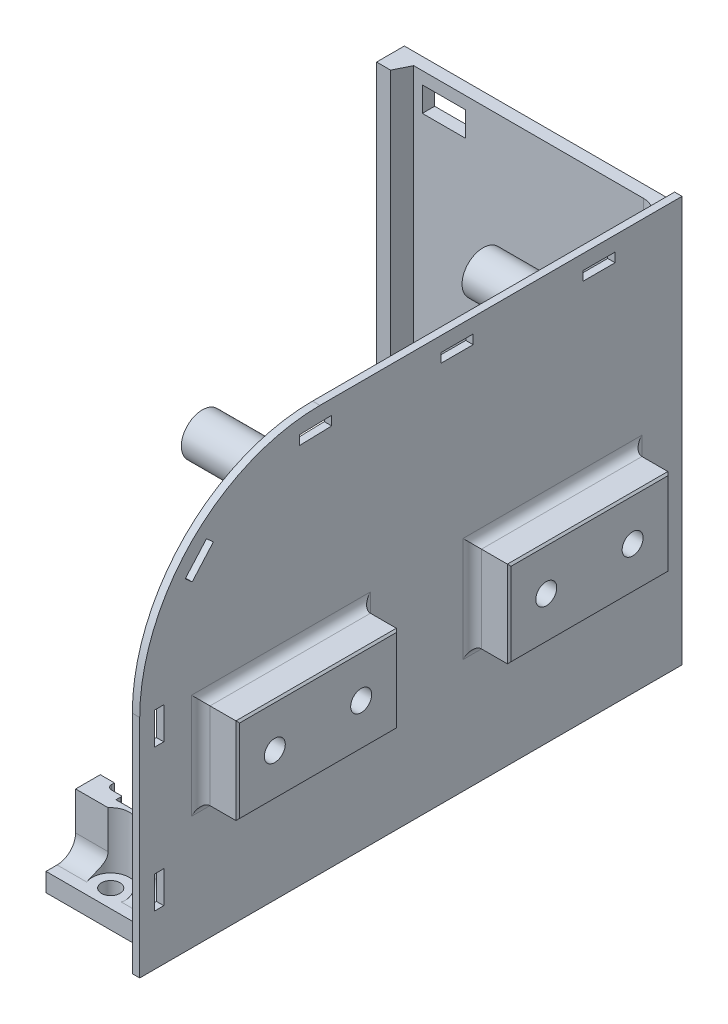
from build123d import *

# Parameters (mm, degrees)
EXTRUDE_1_DEPTH                 = 2
EXTRUDE_2_DEPTH                 = 1.2
SKETCH_4_R                      = 1.55
EXTRUDE_3_DEPTH                 = 4
EXTRUDE_START                   = 3
SKETCH_4_3_R                    = 1.55
EXTRUDE_4_DEPTH                 = 4
FILLET_1_R                      = 3
SKETCH_5_W                      = 3.5
SKETCH_5_H                      = 2.5
EXTRUDE_5_DEPTH                 = 59.375418161
SKETCH_9_W                      = 7
SKETCH_9_H                      = 4
CUT_EXTRUDE_3_DEPTH             = 2
OTHER_START                     = -350.004341608
OTHER_1_OUTLINE_W               = 1.5
OTHER_1_OUTLINE_H               = 5.2
OTHER_1_OUTLINE_W_2             = 5.2
OTHER_1_OUTLINE_H_2             = 1.5
OTHER_1_DEPTH                   = 1.2
SKETCH_10_R                     = 3.4
SKETCH_10_R_2                   = 1.1
EXTRUDE_6_DEPTH                 = 13.8
EXTRUDE_7_DEPTH                 = 2.4
CHAMFER_1_SIZE2                 = 1.219331471
CHAMFER_1_SIZE                  = 2.5
EXTRUDE_9_DEPTH                 = 15.389983971
SKETCH_15_R                     = 1.5
CUT_EXTRUDE_4_DEPTH             = 407.679532375
FILLET_2_R                      = 3
SKETCH_16_R                     = 3
CUT_EXTRUDE_5_DEPTH             = 408.922716855
SKETCH_17_W                     = 26
SKETCH_17_H                     = 14
EXTRUDE_10_DEPTH                = 6
CUT_EXTRUDE_6_REACH             = 113.55
SKETCH_18_R                     = 1.7
CUT_EXTRUDE_6_DIRECTION_2_DEPTH = 112.550133095
PATTERN_LINEAR_1_COUNT          = 2
PATTERN_LINEAR_1_PITCH          = 44
FILLET_3_R                      = 1.5
CHAMFER_2_SIZE                  = 0.3


# Read off the part's stored shape, not the designer's step: Отступ1
# Some blends are built 0.0001 mm under size
with BuildPart() as part:
    # Эскиз2 → Бобышка-Вытянуть1 (new body)
    with BuildSketch(Plane.XY.offset(0.1)):
        Polygon((-376.904341608, -14.952219826), (-393.804341608, -14.952219826), (-393.804341608, 44.423198335), (-348.804341608, 44.423198335), (-348.804341608, -19.952219826), (-376.904341608, -19.952219826), align=None)
    extrude(amount=EXTRUDE_1_DEPTH)

    # Эскиз3 → Бобышка-Вытянуть2 (add)
    with BuildSketch(Plane(origin=(-348.804341608, 0, 0), x_dir=(0, 0, -1), z_dir=(1, 0, 0))):
        with BuildLine():
            Line((-0.1, -19.952219826), (-0.1, 45.823198335))
            Line((-0.1, 45.823198335), (-58.7849644, 45.823198335))
            ThreePointArc((-58.7849644, 45.823198335), (-79.43775717, 37.268531468), (-87.992424037, 16.615738698))
            Line((-87.992424037, 16.615738698), (-87.992424037, -19.952219826))
            Line((-87.992424037, -19.952219826), (-0.1, -19.952219826))
        make_face()
    extrude(amount=-EXTRUDE_2_DEPTH)

    # Эскиз4 → Бобышка-Вытянуть3 (add)
    with BuildSketch(Plane(origin=(0, -17.952219826, 0), x_dir=(1, 0, 0), z_dir=(0, 1, 0))):
        with BuildLine():
            Line((-357.604341608, -2.1), (-357.604341608, -5.7))
            ThreePointArc((-357.604341608, -5.7), (-356.608504664, -8.104163056), (-354.204341608, -9.1))
            Line((-354.204341608, -9.1), (-350.004341608, -9.1))
            Line((-350.004341608, -9.1), (-350.004341608, -2.1))
            Line((-350.004341608, -2.1), (-357.604341608, -2.1))
        make_face()
        with Locations(Location((-354.204341608, -5.7, 0), (0, 0, 270))):
            Circle(SKETCH_4_R, mode=Mode.SUBTRACT)
    extrude(amount=EXTRUDE_3_DEPTH)

    # Эскиз4<3> → Бобышка-Вытянуть4 (add)
    with BuildSketch(Plane(origin=(0, -17.952219826, 0), x_dir=(1, 0, 0), z_dir=(0, 1, 0)).offset(EXTRUDE_START)):
        with BuildLine():
            Line((-390.304341608, -5.7), (-390.304341608, -2.1))
            Line((-390.304341608, -2.1), (-381.365657691, -2.1))
            Line((-381.365657691, -2.1), (-383.84844185, -7.190461899))
            ThreePointArc((-383.84844185, -7.190461899), (-387.669175192, -9.01285822), (-390.304341608, -5.7))
        make_face()
        with Locations(Location((-386.904341608, -5.7, 0), (0, 0, 180))):
            Circle(SKETCH_4_3_R, mode=Mode.SUBTRACT)
    extrude(amount=EXTRUDE_4_DEPTH)

    # Скругление1
    fillet_1_edges = [part.edges().sort_by_distance(p)[0] for p in [
        (-350.004341608, -18.952219826, 2.1),
        (-350.004341608, 15.235489254, 2.1),
    ]]
    fillet(fillet_1_edges, radius=FILLET_1_R)

    # Эскиз5 → Бобышка-Вытянуть5 (add)
    with BuildSketch(Plane(origin=(0, 44.423198335, 0), x_dir=(1, 0, 0), z_dir=(0, 1, 0))):
        with Locations((-392.054341608, -3.35)):
            Rectangle(SKETCH_5_W, SKETCH_5_H)
    extrude(amount=-EXTRUDE_5_DEPTH)

    # Эскиз9 → Вырез-Вытянуть3 (cut)
    with BuildSketch(Plane(origin=(0, 0, 0.1), x_dir=(-1, 0, 0), z_dir=(0, 0, -1))):
        with Locations((385.390488384, 40.423198335)):
            Rectangle(SKETCH_9_W, SKETCH_9_H)
    extrude(amount=-CUT_EXTRUDE_3_DEPTH, mode=Mode.SUBTRACT)

    # Отступ1 outline → Отступ1 (cut)
    with BuildSketch(Plane.YZ.offset(OTHER_START)):
        with Locations((42.673198335, 13.546937644)):
            Rectangle(OTHER_1_OUTLINE_W, OTHER_1_OUTLINE_H)
        with Locations((42.673198335, 36.546937644)):
            Rectangle(OTHER_1_OUTLINE_W, OTHER_1_OUTLINE_H)
        Polygon((41.843105902, 62.072434127), (41.984560077, 56.874358452), (43.484004983, 56.915162541), (43.342550808, 62.113238216), align=None)
        Polygon((31.397725301, 79.490528515), (35.298941914, 76.052431812), (36.290700579, 77.177782758), (32.389483966, 80.615879461), align=None)
        with Locations((13.847780174, 84.842424037)):
            Rectangle(OTHER_1_OUTLINE_W_2, OTHER_1_OUTLINE_H_2)
        with Locations((-9.152219826, 84.842424037)):
            Rectangle(OTHER_1_OUTLINE_W_2, OTHER_1_OUTLINE_H_2)
    extrude(amount=OTHER_1_DEPTH, mode=Mode.SUBTRACT)

    # Эскиз10 → Бобышка-Вытянуть6 (add)
    # profile 1 of 2: a face of its own
    with BuildSketch(Plane.ZY.offset(350.004341608)):
        with Locations(Location((62.85, 36.323198334, 0), (0, 0, 180))):
            Circle(SKETCH_10_R)
        with Locations(Location((62.85, 36.323198334, 0), (0, 0, 180))):
            Circle(SKETCH_10_R_2, mode=Mode.SUBTRACT)
    # profile 2 of 2: a face of its own
    with BuildSketch(Plane.ZY.offset(350.004341608)):
        with Locations(Location((17.35, 36.323198334, 0), (0, 0, 180))):
            Circle(SKETCH_10_R)
        with Locations(Location((17.35, 36.323198334, 0), (0, 0, 180))):
            Circle(SKETCH_10_R_2, mode=Mode.SUBTRACT)
    extrude(amount=EXTRUDE_6_DEPTH)

    # Эскиз12 → Бобышка-Вытянуть7 (add)
    with BuildSketch(Plane.ZY.offset(350.004341608)):
        with BuildLine():
            Line((77.792424037, 16.615738698), (77.792424037, -19.952219826))
            Line((77.792424037, -19.952219826), (79.792424037, -19.952219826))
            Line((79.792424037, -19.952219826), (79.792424037, 16.615738698))
            ThreePointArc((79.792424037, 16.615738698), (73.639481564, 31.470255863), (58.7849644, 37.623198335))
            Line((58.7849644, 37.623198335), (0.1, 37.623198335))
            Line((0.1, 37.623198335), (0.1, 35.623198335))
            Line((0.1, 35.623198335), (58.7849644, 35.623198335))
            ThreePointArc((58.7849644, 35.623198335), (72.225268002, 30.0560423), (77.792424037, 16.615738698))
        make_face()
    extrude(amount=EXTRUDE_7_DEPTH)

    # Фаска1
    chamfer_1_edges = [part.edges().sort_by_distance(p)[0] for p in [
        (-390.304341608, 16.735489254, 4.6),
    ]]
    chamfer_1_side = [part.faces().sort_by_distance(p)[0] for p in [
        (-390.304341608, 16.735489254, 4.575613371),
    ]]
    chamfer(chamfer_1_edges, length=CHAMFER_1_SIZE - 0.0001, length2=CHAMFER_1_SIZE2 - 0.0001, reference=chamfer_1_side[0])  # a hair under: the kernel refuses the full size

    # Эскиз14 → Бобышка-Вытянуть9 (add)
    with BuildSketch(Plane.ZY.offset(350.004341608)):
        Polygon((77.792424037, -16.979951829), (86.592424037, -16.979951829), (86.592424037, -13.979951829), (81.792424037, -13.979951829), (81.792424037, -4.809951829), (77.792424037, -4.809951829), align=None)
    extrude(amount=EXTRUDE_9_DEPTH)

    # Эскиз15 → Вырез-Вытянуть4 (cut, through all)
    with BuildSketch(Plane(origin=(0, -4.809951829, 0), x_dir=(1, 0, 0), z_dir=(0, 1, 0))):
        with Locations(Location((-357.804325578, -83.692424037, 0), (0, 0, 270))):
            Circle(SKETCH_15_R)
        with BuildLine():
            Line((-363.104325578, -78.236115217), (-363.104325578, -76.736115217))
            Line((-363.104325578, -76.736115217), (-352.504325578, -76.736115217))
            Line((-352.504325578, -76.736115217), (-352.504325578, -78.236115217))
            ThreePointArc((-352.504325578, -78.236115217), (-352.738640153, -78.801800642), (-353.304325578, -79.036115217))
            Line((-353.304325578, -79.036115217), (-354.804325578, -79.036115217))
            ThreePointArc((-354.804325578, -79.036115217), (-354.945746935, -79.09469386), (-355.004325578, -79.236115217))
            Line((-355.004325578, -79.236115217), (-355.004325578, -80.036115217))
            Line((-355.004325578, -80.036115217), (-360.604325578, -80.036115217))
            Line((-360.604325578, -80.036115217), (-360.604325578, -79.236115217))
            ThreePointArc((-360.604325578, -79.236115217), (-360.662904222, -79.09469386), (-360.804325578, -79.036115217))
            Line((-360.804325578, -79.036115217), (-362.304325578, -79.036115217))
            ThreePointArc((-362.304325578, -79.036115217), (-362.870011003, -78.801800642), (-363.104325578, -78.236115217))
        make_face()
    extrude(amount=-CUT_EXTRUDE_4_DEPTH, mode=Mode.SUBTRACT)

    # Скругление2
    # the kernel refuses this fillet: 3 mm, written as the material it adds along each edge
    with BuildSketch(Plane(origin=(-350.004341608, -13.979951829, 81.792424037), x_dir=(0, 1, 0), z_dir=(-1, 0, 0))) as fillet_2_piece_1_section:
        with BuildLine():
            CenterArc((FILLET_2_R, -FILLET_2_R), FILLET_2_R, 90, 90)
            Line((0, -FILLET_2_R), (0, 0))
            Line((0, 0), (FILLET_2_R, 0))
        make_face()
    fillet_2_piece_1 = extrude(amount=15.389983971, mode=Mode.PRIVATE)
    fillet_2_piece_1 = fillet_2_piece_1 - Plane(origin=(-357.804325578, -11.764674138, 83.692424037), x_dir=(0, 0, 1), z_dir=(0, 1, 0)) * Cylinder(1.5, 43, mode=Mode.PRIVATE)
    add(fillet_2_piece_1)

    # Эскиз16 → Вырез-Вытянуть5 (cut, through all)
    with BuildSketch(Plane(origin=(0, -13.979951829, 0), x_dir=(1, 0, 0), z_dir=(0, 1, 0))):
        with Locations((-357.804325578, -83.692424037)):
            Circle(SKETCH_16_R)
    extrude(amount=CUT_EXTRUDE_5_DEPTH, mode=Mode.SUBTRACT)

    # Эскиз17 → Бобышка-Вытянуть10 (add)
    with BuildSketch(Plane(origin=(-348.804341608, 0, 0), x_dir=(0, 0, -1), z_dir=(1, 0, 0))):
        with Locations((-21.1, 7.047780174)):
            Rectangle(SKETCH_17_W, SKETCH_17_H)
    extrude_10 = extrude(amount=EXTRUDE_10_DEPTH)

    # Эскиз18 → Вырез-Вытянуть6 (cut, up to next)
    with BuildSketch(Plane(origin=(-342.804341608, 0, 0), x_dir=(0, 0, -1), z_dir=(1, 0, 0)), mode=Mode.PRIVATE) as cut_extrude_6_sk1:
        with Locations((-14.1, 7.047780174)):
            Circle(SKETCH_18_R)
    cut_extrude_6_tool1 = extrude(cut_extrude_6_sk1.sketch, amount=-CUT_EXTRUDE_6_REACH, mode=Mode.PRIVATE) & part.part
    # Эскиз18 → Вырез-Вытянуть6 (cut, up to next)
    with BuildSketch(Plane(origin=(-342.804341608, 0, 0), x_dir=(0, 0, -1), z_dir=(1, 0, 0)), mode=Mode.PRIVATE) as cut_extrude_6_sk2:
        with Locations(Location((-28.1, 7.047780174, 0), (0, 0, 180))):
            Circle(SKETCH_18_R)
    cut_extrude_6_tool2 = extrude(cut_extrude_6_sk2.sketch, amount=-CUT_EXTRUDE_6_REACH, mode=Mode.PRIVATE) & part.part
    cut_extrude_6_1 = cut_extrude_6_tool1.solids().sort_by_distance((-342.804342, 7.04778, 14.1))[0]
    add(cut_extrude_6_1, mode=Mode.SUBTRACT)
    cut_extrude_6_2 = cut_extrude_6_tool2.solids().sort_by_distance((-342.804342, 7.04778, 28.1))[0]
    add(cut_extrude_6_2, mode=Mode.SUBTRACT)
    cut_extrude_6 = cut_extrude_6_1 + cut_extrude_6_2  # Вырез-Вытянуть6 as one shape, for the pattern or mirror that repeats it

    # Эскиз18 → Вырез-Вытянуть6 direction 2 (cut)
    with BuildSketch(Plane(origin=(-342.804341608, 0, 0), x_dir=(0, 0, -1), z_dir=(1, 0, 0))):
        with Locations((-14.1, 7.047780174)):
            Circle(SKETCH_18_R)
        with Locations(Location((-28.1, 7.047780174, 0), (0, 0, 180))):
            Circle(SKETCH_18_R)
    cut_extrude_6_direction_2 = extrude(amount=CUT_EXTRUDE_6_DIRECTION_2_DEPTH, mode=Mode.SUBTRACT)

    # Линейный массив1: Бобышка-Вытянуть10, Вырез-Вытянуть6, Вырез-Вытянуть6 direction 2 ×2
    with Locations(*[(0, 0, i * PATTERN_LINEAR_1_PITCH) for i in range(1, PATTERN_LINEAR_1_COUNT)]):
        add(extrude_10)
        add(cut_extrude_6, mode=Mode.SUBTRACT)
        add(cut_extrude_6_direction_2, mode=Mode.SUBTRACT)

    # Скругление3
    fillet_3_edges = [part.edges().sort_by_distance(p)[0] for p in [
        (-348.804341608, 7.047780174, 8.1),
        (-348.804341608, 14.047780174, 21.1),
        (-348.804341608, 7.047780174, 34.1),
        (-348.804341608, 0.047780174, 21.1),
        (-348.804341608, 7.047780174, 52.1),
        (-348.804341608, 14.047780174, 65.1),
        (-348.804341608, 7.047780174, 78.1),
        (-348.804341608, 0.047780174, 65.1),
    ]]
    fillet(fillet_3_edges, radius=FILLET_3_R)

    # Фаска2
    chamfer_2_edges = [part.edges().sort_by_distance(p)[0] for p in [
        (-342.804341608, 7.047780174, 8.1),
        (-342.804341608, 14.047780174, 21.1),
        (-342.804341608, 7.047780174, 34.1),
        (-342.804341608, 0.047780174, 21.1),
        (-342.804341608, 7.047780174, 52.1),
        (-342.804341608, 14.047780174, 65.1),
        (-342.804341608, 7.047780174, 78.1),
        (-342.804341608, 0.047780174, 65.1),
    ]]
    chamfer(chamfer_2_edges, length=CHAMFER_2_SIZE)


solid = part.part
